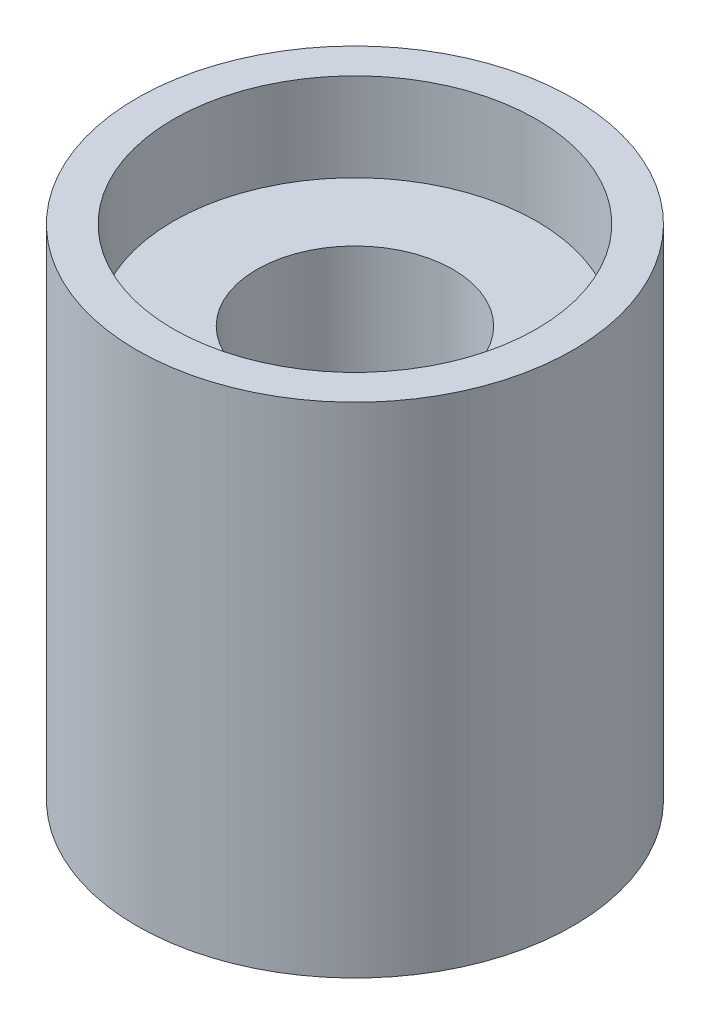
from build123d import *

# Parameters (mm, degrees)
SKETCH1_R           = 22.225
BOSS_EXTRUDE1_DEPTH = 50.8
SKETCH2_R           = 18.5039
CUT_EXTRUDE1_DEPTH  = 8.9916
CUT_EXTRUDE2_START  = -8.9916
SKETCH4_R           = 18.5039
CUT_EXTRUDE2_DEPTH  = 8.9916
SKETCH5_R           = 9.9949
CUT_EXTRUDE3_DEPTH  = 53.305291898


with BuildPart() as part:
    # Sketch1 → Boss-Extrude1 (new body)
    with BuildSketch(Plane(origin=(0, 0, 0), x_dir=(1, 0, 0), z_dir=(0, 1, 0))):
        Circle(SKETCH1_R)
    extrude(amount=BOSS_EXTRUDE1_DEPTH)

    # Sketch2 → Cut-Extrude1 (cut)
    with BuildSketch(Plane(origin=(0, 50.8, 0), x_dir=(1, 0, 0), z_dir=(0, 1, 0))):
        Circle(SKETCH2_R)
    extrude(amount=-CUT_EXTRUDE1_DEPTH, mode=Mode.SUBTRACT)

    # Sketch4 → Cut-Extrude2 (cut)
    with BuildSketch(Plane.XZ.offset(CUT_EXTRUDE2_START)):
        Circle(SKETCH4_R)
    extrude(amount=CUT_EXTRUDE2_DEPTH, mode=Mode.SUBTRACT)

    # Sketch5 → Cut-Extrude3 (cut, through all)
    with BuildSketch(Plane.XZ.offset(-8.9916)):
        Circle(SKETCH5_R)
    extrude(amount=-CUT_EXTRUDE3_DEPTH, mode=Mode.SUBTRACT)


solid = part.part
